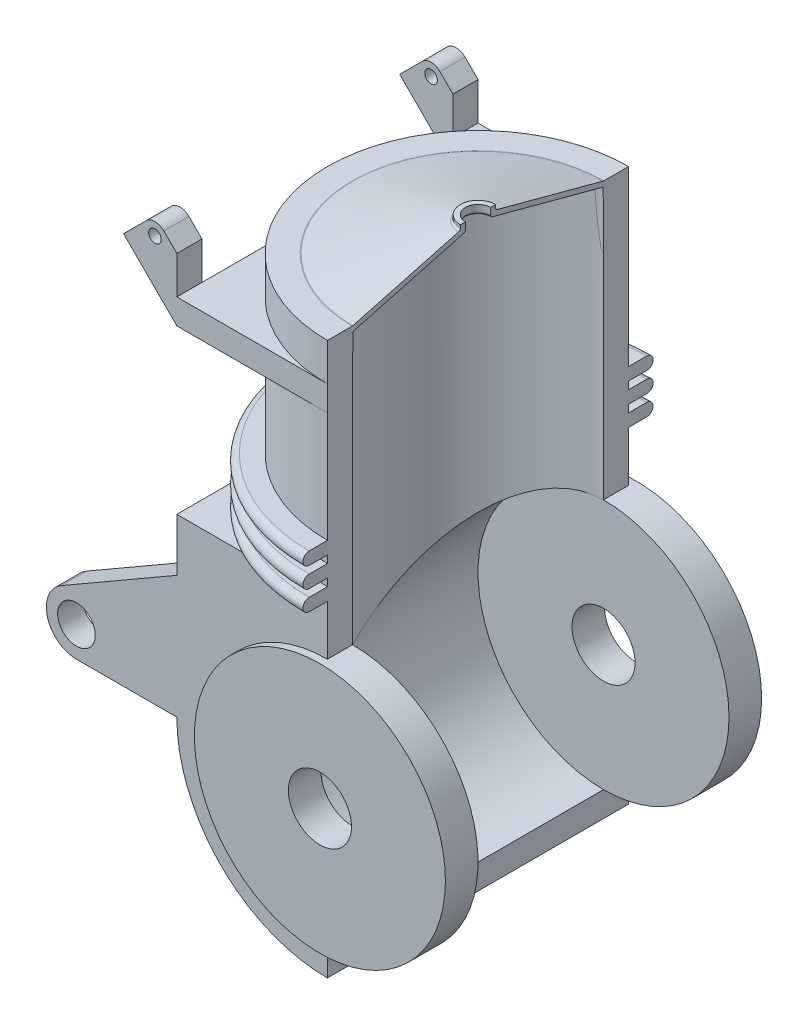
from build123d import *

# Parameters (mm, degrees)
BOSS_EXTRUDE1_DEPTH      = 110
REVOLVE4_ANGLE           = 180
SKETCH5_R                = 2.5
BOSS_EXTRUDE2_DEPTH      = 120
CUT_EXTRUDE2_REACH       = 151.317
CUT_EXTRUDE2_END_RADIUS  = 50
REVOLVE5_ANGLE           = 180
CUT_EXTRUDE4_DEPTH       = 15
CUT_EXTRUDE5_DEPTH       = 85
CUT_EXTRUDE5_DEPTH_BACK  = 75
SKETCH7_5_W              = 21.213203436
SKETCH7_5_H              = 100
REVOLVE6_ANGLE           = 180
BOSS_EXTRUDE3_DEPTH      = 3
BOSS_EXTRUDE3_DEPTH_BACK = 10
SKETCH9_R                = 50
BOSS_EXTRUDE4_START      = -110
SKETCH9_3_R              = 50
BOSS_EXTRUDE4_DEPTH      = 13
BOSS_EXTRUDE5_DEPTH      = 120
CUT_EXTRUDE6_START       = -110
CUT_EXTRUDE6_DEPTH       = 20
CUT_EXTRUDE7_DEPTH       = 50
SKETCH9_5_R              = 7.5
BOSS_EXTRUDE6_DEPTH      = 10
BOSS_EXTRUDE7_START      = -110
SKETCH9_6_R              = 7.5
BOSS_EXTRUDE7_DEPTH      = 10
SKETCH12_R               = 12.571901436
CUT_EXTRUDE8_DEPTH       = 281.297435946
BOSS_EXTRUDE9_START      = 15
BOSS_EXTRUDE9_DEPTH      = 15


# Read off the part's stored shape, not the designer's step: Cut-Extrude6
with BuildPart() as part:
    # Sketch1 → Boss-Extrude1 (new body)
    with BuildSketch(Plane(origin=(0, 0, 0), x_dir=(1, 0, 0), z_dir=(0, 1, 0))):
        with BuildLine():
            Line((0, 60), (0, 50))
            ThreePointArc((0, 50), (-50, 0), (0, -50))
            Line((0, -50), (0, -60))
            ThreePointArc((0, -60), (-60, 0), (0, 60))
        make_face()
    extrude(amount=-BOSS_EXTRUDE1_DEPTH)

    # Sketch2 → Revolve4 (revolve)
    with BuildSketch(Plane(origin=(0, 0, 0), x_dir=(0, 0, -1), z_dir=(1, 0, 0))):
        with BuildLine():
            ThreePointArc((-7.741180955, 11.323216436), (-7.20664666, 11.680380834), (-7, 12.289142263))
            Line((-7, 12.289142263), (-7, 13.397459622))
            Line((-7, 13.397459622), (-5, 13.397459622))
            Line((-5, 13.397459622), (-5, 12.057713659))
            Line((-5, 12.057713659), (-5, 10.754488287))
            ThreePointArc((-5, 10.754488287), (-5.20664666, 10.145726858), (-5.741180955, 9.78856246))
            Line((-5.741180955, 9.78856246), (-49.872833452, -2.036478187))
            ThreePointArc((-49.872833452, -2.036478187), (-50.001126305, -2.061997222), (-50.131652498, -2.070552361))
            Line((-50.131652498, -2.070552361), (-60, -2.070552361))
            Line((-60, -2.070552361), (-60, 0))
            Line((-60, 0), (-50.131652498, 0))
            ThreePointArc((-50.131652498, 0), (-50.001126305, 0.008555139), (-49.872833452, 0.034074174))
            Line((-49.872833452, 0.034074174), (-7.741180955, 11.323216436))
        make_face()
    revolve(axis=Axis((0, 9.451262914, 0), (0, -1, 0)), revolution_arc=REVOLVE4_ANGLE)

    # Sketch5 → Boss-Extrude2 (add)
    with BuildSketch(Plane.XY.offset(60)):
        with BuildLine():
            Line((-60, -25), (0, -25))
            Line((0, -25), (0, -15))
            Line((0, -15), (0, 0))
            Line((0, 0), (-60, 0))
            Line((-60, 0), (-65.17766953, 5.17766953))
            ThreePointArc((-65.17766953, 5.17766953), (-68.713203436, 6.642135624), (-72.248737342, 5.17766953))
            Line((-72.248737342, 5.17766953), (-76.213203436, 1.213203436))
            Line((-76.213203436, 1.213203436), (-81.213203436, -3.786796564))
            Line((-81.213203436, -3.786796564), (-60, -25))
        make_face()
        with Locations((-68.713203436, 1.642135624)):
            Circle(SKETCH5_R, mode=Mode.SUBTRACT)
    extrude(amount=-BOSS_EXTRUDE2_DEPTH)

    # Cut-Extrude2: up to this cylinder (the profile starts inside it)
    cut_extrude2_end = Plane(origin=(0, -12.579447, 0), z_dir=(0, 1, 0)) * Cylinder(CUT_EXTRUDE2_END_RADIUS, 403.634, mode=Mode.PRIVATE)
    # Sketch6 → Cut-Extrude2 (cut, up to the surface)
    with BuildSketch(Plane(origin=(0, 0, 0), x_dir=(0, 0, -1), z_dir=(1, 0, 0)), mode=Mode.PRIVATE) as cut_extrude2_sk1:
        Polygon((-49.872833452, -2.036478187), (-50, -25), (50, -25), (49.872833452, -2.036478187), (42.27259339, 0), (-42.27259339, 0), align=None)
    cut_extrude2_tool1 = extrude(cut_extrude2_sk1.sketch, amount=-CUT_EXTRUDE2_REACH, mode=Mode.PRIVATE) & cut_extrude2_end
    add(cut_extrude2_tool1.solids().sort_by_distance((0, -12.579447, 0))[0], mode=Mode.SUBTRACT)

    # Sketch2<8> → Revolve5 (revolve)
    with BuildSketch(Plane(origin=(0, 0, 0), x_dir=(0, 0, -1), z_dir=(1, 0, 0))):
        with BuildLine():
            Line((-49.872833452, 0.034074174), (-7.741180955, 11.323216436))
            ThreePointArc((-7.741180955, 11.323216436), (-7.20664666, 11.680380834), (-7, 12.289142263))
            Line((-7, 12.289142263), (-7, 13.397459622))
            Line((-7, 13.397459622), (-5, 13.397459622))
            Line((-5, 13.397459622), (-5, 12.057713659))
            Line((-5, 12.057713659), (-5, 10.754488287))
            ThreePointArc((-5, 10.754488287), (-5.20664666, 10.145726858), (-5.741180955, 9.78856246))
            Line((-5.741180955, 9.78856246), (-49.872833452, -2.036478187))
            ThreePointArc((-49.872833452, -2.036478187), (-50.001126305, -2.061997222), (-50.131652498, -2.070552361))
            Line((-50.131652498, -2.070552361), (-60, -2.070552361))
            Line((-60, -2.070552361), (-60, 0))
            Line((-60, 0), (-50.131652498, 0))
            ThreePointArc((-50.131652498, 0), (-50.001126305, 0.008555139), (-49.872833452, 0.034074174))
        make_face()
    revolve(axis=Axis((0, 9.451262914, 0), (0, -1, 0)), revolution_arc=REVOLVE5_ANGLE)

    # Sketch7 → Cut-Extrude4 (cut)
    with BuildSketch(Plane(origin=(0, 0, 0), x_dir=(1, 0, 0), z_dir=(0, 1, 0))):
        with BuildLine():
            ThreePointArc((0, -50.131652498), (-50.131652498, 0), (0, 50.131652498))
            Line((0, 50.131652498), (0, 60))
            Line((0, 60), (-60, 60))
            Line((-60, 60), (-60, 50))
            Line((-60, 50), (-60, -50))
            Line((-60, -50), (-60, -60))
            Line((-60, -60), (0, -60))
            Line((0, -60), (0, -50.131652498))
        make_face()
    extrude(amount=-CUT_EXTRUDE4_DEPTH, mode=Mode.SUBTRACT)

    # Sketch7<5> → Cut-Extrude5 (cut, two sides: drawn at the far end of the back side and taken through both)
    with BuildSketch(Plane(origin=(0, 0, 0), x_dir=(1, 0, 0), z_dir=(0, 1, 0)).offset(-CUT_EXTRUDE5_DEPTH_BACK)):
        with Locations((-70.606601718, 0)):
            Rectangle(SKETCH7_5_W, SKETCH7_5_H)
    extrude(amount=CUT_EXTRUDE5_DEPTH + CUT_EXTRUDE5_DEPTH_BACK, mode=Mode.SUBTRACT)

    # Sketch8 → Revolve6 (revolve)
    with BuildSketch(Plane(origin=(0, 0, 0), x_dir=(0, 0, -1), z_dir=(1, 0, 0))):
        with BuildLine():
            Line((60, -77), (60, -82))
            Line((60, -82), (67.250339251, -82))
            ThreePointArc((67.250339251, -82), (69.750339251, -79.5), (67.250339251, -77))
            Line((67.250339251, -77), (60, -77))
        make_face()
        with BuildLine():
            Line((67.250339251, -85), (60, -85))
            Line((60, -85), (60, -90))
            Line((60, -90), (67.250339251, -90))
            ThreePointArc((67.250339251, -90), (69.750339251, -87.5), (67.250339251, -85))
        make_face()
        with BuildLine():
            Line((60, -69), (60, -74))
            Line((60, -74), (67.250339251, -74))
            ThreePointArc((67.250339251, -74), (69.750339251, -71.5), (67.250339251, -69))
            Line((67.250339251, -69), (60, -69))
        make_face()
    revolve(axis=Axis((0, -110, 0), (0, 1, 0)), revolution_arc=REVOLVE6_ANGLE)



with BuildPart() as body_2:
    # Sketch9 → Boss-Extrude3 (new, two sides: drawn at the far end of the back side and taken through both)
    with BuildSketch(Plane.XY.offset(60).offset(-BOSS_EXTRUDE3_DEPTH_BACK)):
        with Locations((0, -160)):
            Circle(SKETCH9_R)
    extrude(amount=BOSS_EXTRUDE3_DEPTH + BOSS_EXTRUDE3_DEPTH_BACK)


with BuildPart() as body_3:
    # Sketch9<3> → Boss-Extrude4 (new body)
    with BuildSketch(Plane.XY.offset(60).offset(BOSS_EXTRUDE4_START)):
        with Locations((0, -160)):
            Circle(SKETCH9_3_R)
    extrude(amount=-BOSS_EXTRUDE4_DEPTH)


with BuildPart() as part_1:
    add(part.part)

    add(body_2.part)  # Boss-Extrude5 merges body 2

    add(body_3.part)  # Boss-Extrude5 merges body 3
    # Sketch9<4> → Boss-Extrude5 (add)
    with BuildSketch(Plane.XY.offset(60)):
        with BuildLine():
            Line((-60, -111.049582772), (-60, -160))
            ThreePointArc((-60, -160), (-42.426406871, -202.426406871), (0, -220))
            Line((0, -220), (0, -210))
            ThreePointArc((0, -210), (-50, -160), (0, -110))
            Line((0, -110), (0, -90))
            Line((0, -90), (-60, -90))
            Line((-60, -90), (-60, -111.049582772))
        make_face()
    extrude(amount=-BOSS_EXTRUDE5_DEPTH)

    # Cut-Extrude6 outline → Cut-Extrude6 (cut)
    with BuildSketch(Plane(origin=(0, 0, 0), x_dir=(1, 0, 0), z_dir=(0, 1, 0)).offset(CUT_EXTRUDE6_START)):
        with BuildLine():
            Line((0, -50), (0, 50))
            ThreePointArc((0, 50), (-50, 0), (0, -50))
        make_face()
    extrude(amount=CUT_EXTRUDE6_DEPTH, mode=Mode.SUBTRACT)

    # Sketch11 → Cut-Extrude7 (cut)
    with BuildSketch(Plane(origin=(0, -110, 0), x_dir=(1, 0, 0), z_dir=(0, 1, 0))):
        with BuildLine():
            Line((0, -50), (0, 50))
            ThreePointArc((0, 50), (-50, 0), (0, -50))
        make_face()
    extrude(amount=-CUT_EXTRUDE7_DEPTH, mode=Mode.SUBTRACT)

    # Sketch9<5> → Boss-Extrude6 (add)
    with BuildSketch(Plane.XY.offset(60)):
        with BuildLine():
            ThreePointArc((-100, -160), (-111.591109915, -151.105828541), (-106, -137.607695155))
            Line((-106, -137.607695155), (-60, -111.049582772))
            Line((-60, -111.049582772), (-60, -160))
            Line((-60, -160), (-100, -160))
        make_face()
        with Locations((-100, -148)):
            Circle(SKETCH9_5_R, mode=Mode.SUBTRACT)
    extrude(amount=-BOSS_EXTRUDE6_DEPTH)

    # Sketch9<6> → Boss-Extrude7 (add)
    with BuildSketch(Plane.XY.offset(60).offset(BOSS_EXTRUDE7_START)):
        with BuildLine():
            ThreePointArc((-100, -160), (-111.591109915, -151.105828541), (-106, -137.607695155))
            Line((-106, -137.607695155), (-60, -111.049582772))
            Line((-60, -111.049582772), (-60, -160))
            Line((-60, -160), (-100, -160))
        make_face()
        with Locations((-100, -148)):
            Circle(SKETCH9_6_R, mode=Mode.SUBTRACT)
    extrude(amount=-BOSS_EXTRUDE7_DEPTH)

    # Sketch12 → Cut-Extrude8 (cut, through all)
    with BuildSketch(Plane.XY.offset(63)):
        with Locations((0, -160)):
            Circle(SKETCH12_R)
    extrude(amount=-CUT_EXTRUDE8_DEPTH, mode=Mode.SUBTRACT)

    # Sketch13 → Boss-Extrude9 (add)
    with BuildSketch(Plane(origin=(0, -15, 0), x_dir=(1, 0, 0), z_dir=(0, 1, 0)).offset(BOSS_EXTRUDE9_START)):
        with BuildLine():
            ThreePointArc((0, 60), (-60, 0), (0, -60))
            Line((0, -60), (0, -50.131652498))
            ThreePointArc((0, -50.131652498), (-50.131652498, 0), (0, 50.131652498))
            Line((0, 50.131652498), (0, 60))
        make_face()
    extrude(amount=-BOSS_EXTRUDE9_DEPTH)


solid = part_1.part
